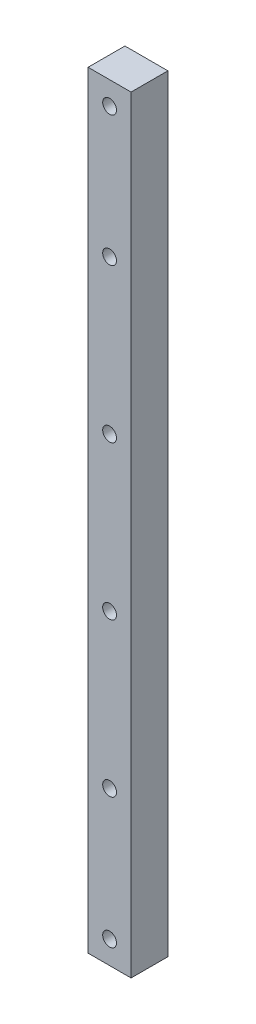
from build123d import *

# Parameters (mm, degrees)
SKETCH1_W           = 14
SKETCH1_H           = 12
BOSS_EXTRUDE1_DEPTH = 250
SKETCH2_R           = 2.25
CUT_EXTRUDE1_DEPTH  = 6
CUT_EXTRUDE2_REACH  = 252.386
SKETCH3_R           = 2.25


with BuildPart() as part:
    # Sketch1 → Boss-Extrude1 (new body)
    with BuildSketch(Plane(origin=(0, 0, 0), x_dir=(1, 0, 0), z_dir=(0, 1, 0))):
        Rectangle(SKETCH1_W, SKETCH1_H)
    extrude(amount=BOSS_EXTRUDE1_DEPTH)

    # Sketch2 → Cut-Extrude1 (cut, symmetric)
    with BuildSketch(Plane.XY):
        with Locations((0, 7.5)):
            Circle(SKETCH2_R)
        with Locations((0, 242.5)):
            Circle(SKETCH2_R)
    extrude(amount=CUT_EXTRUDE1_DEPTH, both=True, mode=Mode.SUBTRACT)

    # Sketch3 → Cut-Extrude2 (cut, up to next)
    with BuildSketch(Plane(origin=(0, 0, -6), x_dir=(-1, 0, 0), z_dir=(0, 0, -1)), mode=Mode.PRIVATE) as cut_extrude2_sk1:
        with Locations((0, 200)):
            Circle(SKETCH3_R)
    cut_extrude2_tool1 = extrude(cut_extrude2_sk1.sketch, amount=-CUT_EXTRUDE2_REACH, mode=Mode.PRIVATE) & part.part
    # Sketch3 → Cut-Extrude2 (cut, up to next)
    with BuildSketch(Plane(origin=(0, 0, -6), x_dir=(-1, 0, 0), z_dir=(0, 0, -1)), mode=Mode.PRIVATE) as cut_extrude2_sk2:
        with Locations((0, 150)):
            Circle(SKETCH3_R)
    cut_extrude2_tool2 = extrude(cut_extrude2_sk2.sketch, amount=-CUT_EXTRUDE2_REACH, mode=Mode.PRIVATE) & part.part
    # Sketch3 → Cut-Extrude2 (cut, up to next)
    with BuildSketch(Plane(origin=(0, 0, -6), x_dir=(-1, 0, 0), z_dir=(0, 0, -1)), mode=Mode.PRIVATE) as cut_extrude2_sk3:
        with Locations((0, 100)):
            Circle(SKETCH3_R)
    cut_extrude2_tool3 = extrude(cut_extrude2_sk3.sketch, amount=-CUT_EXTRUDE2_REACH, mode=Mode.PRIVATE) & part.part
    # Sketch3 → Cut-Extrude2 (cut, up to next)
    with BuildSketch(Plane(origin=(0, 0, -6), x_dir=(-1, 0, 0), z_dir=(0, 0, -1)), mode=Mode.PRIVATE) as cut_extrude2_sk4:
        with Locations((0, 50)):
            Circle(SKETCH3_R)
    cut_extrude2_tool4 = extrude(cut_extrude2_sk4.sketch, amount=-CUT_EXTRUDE2_REACH, mode=Mode.PRIVATE) & part.part
    add(cut_extrude2_tool1.solids().sort_by_distance((0, 200, -6))[0], mode=Mode.SUBTRACT)
    add(cut_extrude2_tool2.solids().sort_by_distance((0, 150, -6))[0], mode=Mode.SUBTRACT)
    add(cut_extrude2_tool3.solids().sort_by_distance((0, 100, -6))[0], mode=Mode.SUBTRACT)
    add(cut_extrude2_tool4.solids().sort_by_distance((0, 50, -6))[0], mode=Mode.SUBTRACT)


solid = part.part
